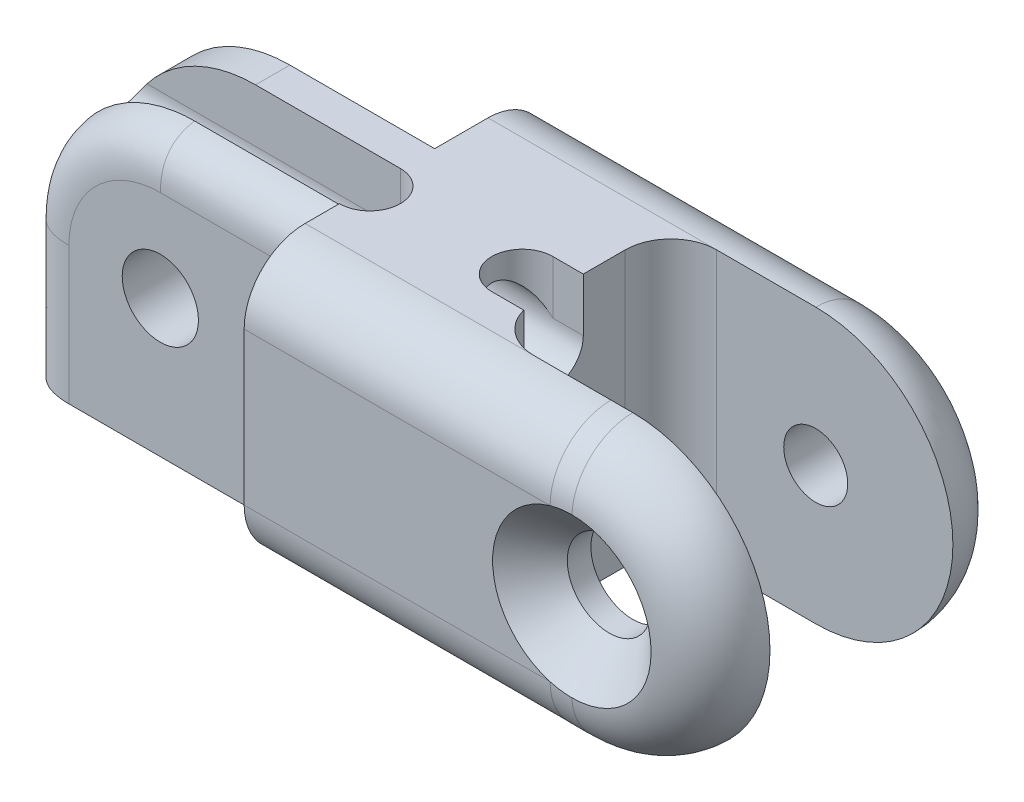
from build123d import *

# Parameters (mm, degrees)
BOSS_EXTRUDE1_DEPTH         = 18
SKETCH5_OUTSIDE_W           = 62.18
SKETCH5_OUTSIDE_H           = 31.18
SKETCH5_OUTSIDE_R           = 2.5
CUT_EXTRUDE1_DEPTH          = 20
M5_TAPPED_HOLE1_D           = 4.2
M5_TAPPED_HOLE1_CSINK_D     = 10.4
M5_TAPPED_HOLE1_CSINK_ANGLE = 90
FILLET1_R                   = 4
FILLET2_R                   = 4
FILLET3_SIZE                = 3
CUT_EXTRUDE2_DEPTH          = 37.800136028
CUT_EXTRUDE2_DEPTH_BACK     = 37.800136028
SKETCH12_R                  = 2
CUT_EXTRUDE3_DEPTH          = 3.5
CUT_EXTRUDE4_DEPTH          = 3.5


# Some blends are built 0.0001 mm under size
with BuildPart() as part:
    # Sketch2 → Boss-Extrude1 (new body)
    with BuildSketch(Plane(origin=(0, 0, 0), x_dir=(1, 0, 0), z_dir=(0, 1, 0))):
        with BuildLine():
            Line((-6, 10), (24.5, 10))
            Line((24.5, 10), (24.5, 6))
            Line((24.5, 6), (9, 6))
            ThreePointArc((9, 6), (6.878679656, 5.121320344), (6, 3))
            Line((6, 3), (6, -3))
            ThreePointArc((6, -3), (6.878679656, -5.121320344), (9, -6))
            Line((9, -6), (24.5, -6))
            Line((24.5, -6), (24.5, -10))
            Line((24.5, -10), (-6, -10))
            Line((-6, -10), (-6, -6))
            Line((-6, -6), (-24.5, -6))
            Line((-24.5, -6), (-24.5, 2.5))
            Line((-24.5, 2.5), (-6, 2.5))
            Line((-6, 2.5), (-6, 10))
        make_face()
    extrude(amount=BOSS_EXTRUDE1_DEPTH)

    # Sketch5 outside → Cut-Extrude1 (cut)
    # profile 1 of 2: a face of its own
    with BuildSketch(Plane.XY.offset(10)):
        with Locations((0, 9)):
            Rectangle(SKETCH5_OUTSIDE_W, SKETCH5_OUTSIDE_H)
        with BuildLine():
            Line((-24.5, 9), (-24.5, 0))
            Line((-24.5, 0), (15.5, 0))
            ThreePointArc((15.5, 0), (24.5, 9), (15.5, 18))
            Line((15.5, 18), (-15.5, 18))
            ThreePointArc((-15.5, 18), (-21.863961031, 15.363961031), (-24.5, 9))
        make_face(mode=Mode.SUBTRACT)
    # profile 2 of 2: a face of its own
    with BuildSketch(Plane.XY.offset(10)):
        with Locations((-15.5, 9)):
            Circle(SKETCH5_OUTSIDE_R)
    extrude(amount=-CUT_EXTRUDE1_DEPTH, mode=Mode.SUBTRACT)

    # Sketch8 → CSK for M5 Countersunk Flat Head Screw1 (revolve, cut)
    with BuildSketch(Plane(origin=(15.5, 9, 10), x_dir=(0, -1, 0), z_dir=(1, 0, 0))):
        Polygon((0, 0), (0, 4), (2.75, 4), (2.75, 2.45), (5.2, 0), align=None)
    revolve(axis=Axis((15.5, 9, 16.35), (0, 0, -1)), mode=Mode.SUBTRACT)

    # M5 Tapped Hole1 (through all)
    with Locations(Plane.XY.offset(10)):
        with Locations((15.5, 9)):
            CounterSinkHole(M5_TAPPED_HOLE1_D / 2, M5_TAPPED_HOLE1_CSINK_D / 2, counter_sink_angle=M5_TAPPED_HOLE1_CSINK_ANGLE)

    # Fillet1
    fillet1_edges = [part.edges().sort_by_distance(p)[0] for p in [
        (4.75, 0, 10),
        (4.75, 18, 10),
    ]]
    fillet(fillet1_edges, radius=FILLET1_R - 0.0001)  # a hair under: the kernel refuses the full size

    # Fillet2
    fillet2_edges = [part.edges().sort_by_distance(p)[0] for p in [
        (4.75, 0, -10),
        (24.5, 9, -10),
        (4.75, 18, -10),
    ]]
    fillet(fillet2_edges, radius=FILLET2_R - 0.0001)  # a hair under: the kernel refuses the full size

    # Fillet3
    # a fillet whose section is not a circle: 3 mm, written as the material it takes off along each edge
    with BuildSketch(Plane(origin=(-24.5, -7.5, 6), x_dir=(0, 0, -1), z_dir=(0, 1, 0))) as fillet3_piece_1:
        with BuildLine():
            Bezier((FILLET3_SIZE, 0), (0, 0), (0, -FILLET3_SIZE), weights=[1, 1, 1])
            Line((0, -FILLET3_SIZE), (0, 0))
            Line((0, 0), (FILLET3_SIZE, 0))
        make_face()
    extrude(amount=16.5, mode=Mode.SUBTRACT)
    with BuildSketch(Plane(origin=(-6, 18, 6), x_dir=(0, -1, 0), z_dir=(-1, 0, 0))) as fillet3_piece_2:
        with BuildLine():
            Bezier((FILLET3_SIZE, 0), (0, 0), (0, -FILLET3_SIZE), weights=[1, 1, 1])
            Line((0, -FILLET3_SIZE), (0, 0))
            Line((0, 0), (FILLET3_SIZE, 0))
        make_face()
    extrude(amount=9.5, mode=Mode.SUBTRACT)
    with BuildSketch(Plane(origin=(-15.5, 9, 6), x_dir=(0, 1, 0), z_dir=(1, 0, 0))) as fillet3_piece_3:
        with BuildLine():
            Bezier((9 - FILLET3_SIZE, 0), (9, 0), (9, -FILLET3_SIZE), weights=[1, 1, 1])
            Line((9, -FILLET3_SIZE), (9, 0))
            Line((9, 0), (9 - FILLET3_SIZE, 0))
        make_face()
    revolve(axis=Axis((-15.5, 9, 6), (0, 0, 1)), revolution_arc=90, mode=Mode.SUBTRACT)

    # Sketch12 → Cut-Extrude2 (cut, two sides: drawn at the far end of the back side and taken through both)
    with BuildSketch(Plane(origin=(6, 0, 0), x_dir=(0, 0, -1), z_dir=(1, 0, 0)).offset(-CUT_EXTRUDE2_DEPTH_BACK)):
        with Locations(Location((-1.75, 14.5, 0), (0, 0, 231.317812547))):
            Circle(SKETCH12_R)
    extrude(amount=CUT_EXTRUDE2_DEPTH + CUT_EXTRUDE2_DEPTH_BACK, mode=Mode.SUBTRACT)

    # Sketch13 → Cut-Extrude3 (cut)
    with BuildSketch(Plane(origin=(0, 18, 0), x_dir=(1, 0, 0), z_dir=(0, 1, 0))):
        with BuildLine():
            Line((-24, 0.25), (-6, 0.25))
            ThreePointArc((-6, 0.25), (-4, -1.75), (-6, -3.75))
            Line((-6, -3.75), (-24, -3.75))
            Line((-24, -3.75), (-24, 0.25))
        make_face()
    extrude(amount=-CUT_EXTRUDE3_DEPTH, mode=Mode.SUBTRACT)

    # Sketch15 → Cut-Extrude4 (cut)
    with BuildSketch(Plane(origin=(0, 18, 0), x_dir=(1, 0, 0), z_dir=(0, 1, 0))):
        with BuildLine():
            Line((4, 0.25), (9, 0.25))
            Line((9, 0.25), (9, -3.75))
            Line((9, -3.75), (4, -3.75))
            ThreePointArc((4, -3.75), (2, -1.75), (4, 0.25))
        make_face()
    extrude(amount=-CUT_EXTRUDE4_DEPTH, mode=Mode.SUBTRACT)


solid = part.part
